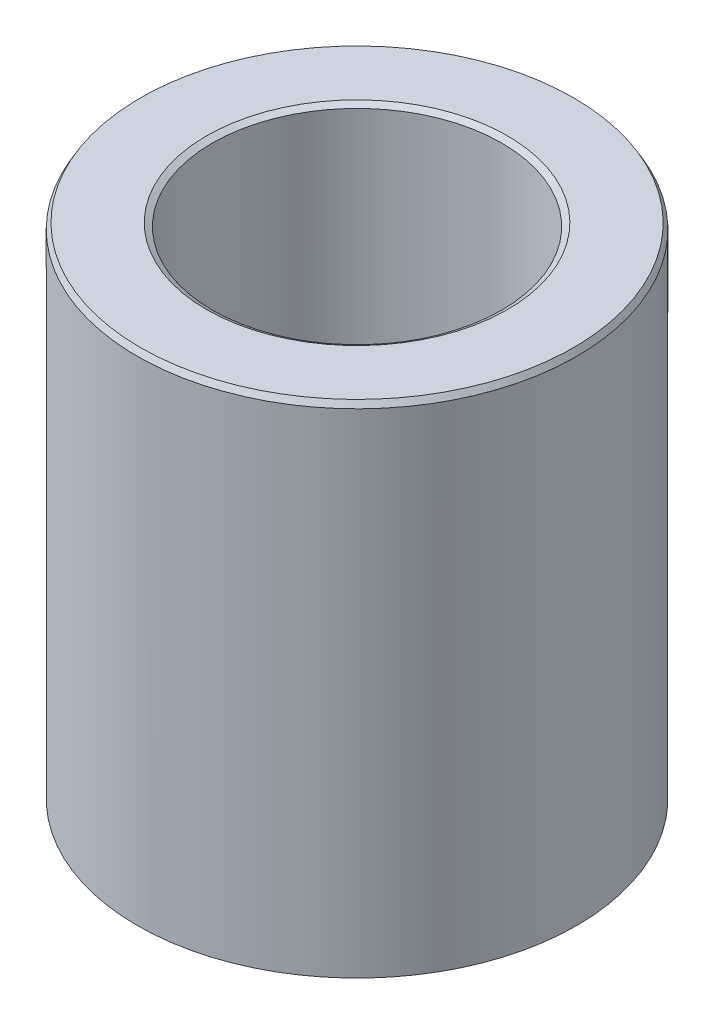
from build123d import *
from OCP.BRepFilletAPI import BRepFilletAPI_MakeChamfer

# Parameters (mm, degrees)
SKETCH1_R           = 45
BOSS_EXTRUDE1_DEPTH = 102.806656635
SKETCH2_R           = 29.628521895
CUT_EXTRUDE1_DEPTH  = 121.909919562
CHAMFER1_SIZE       = 1.183508035
CHAMFER1_SIZE2      = 0.683298682


with BuildPart() as part:
    # Sketch1 → Boss-Extrude1 (new body)
    with BuildSketch(Plane(origin=(0, 0, 0), x_dir=(1, 0, 0), z_dir=(0, 1, 0))):
        Circle(SKETCH1_R)
    extrude(amount=BOSS_EXTRUDE1_DEPTH)

    # Sketch2 → Cut-Extrude1 (cut, through all)
    with BuildSketch(Plane(origin=(0, 0, 0), x_dir=(1, 0, 0), z_dir=(0, 1, 0))):
        Circle(SKETCH2_R)
    extrude(amount=CUT_EXTRUDE1_DEPTH, mode=Mode.SUBTRACT)

    # Chamfer1: one chamfer whose edges measure the first distance from different faces: ONE call of the kernel's chamfer builder (chamfer() names one face for all edges)
    chamfer1_edges_1 = [part.edges().sort_by_distance(p)[0] for p in [
        (-29.628521895, 102.806656635, 0),
    ]]
    chamfer1_side_1 = [part.faces().sort_by_distance(p)[0] for p in [
        (-43.727207794, 102.806656635, 0),
    ]]
    chamfer1_edges_2 = [part.edges().sort_by_distance(p)[0] for p in [
        (-29.628521895, 0, 0),
    ]]
    chamfer1_side_2 = [part.faces().sort_by_distance(p)[0] for p in [
        (-29.628521895, 51.403328318, 0),
    ]]
    chamfer1_edges_3 = [part.edges().sort_by_distance(p)[0] for p in [
        (-45, 0, 0),
    ]]
    chamfer1_side_3 = [part.faces().sort_by_distance(p)[0] for p in [
        (-43.727207794, 0, 0),
    ]]
    chamfer1_edges_4 = [part.edges().sort_by_distance(p)[0] for p in [
        (-45, 102.806656635, 0),
    ]]
    chamfer1_side_4 = [part.faces().sort_by_distance(p)[0] for p in [
        (-45, 51.403328318, 0),
    ]]
    chamfer1 = BRepFilletAPI_MakeChamfer(part.part.solid().wrapped)
    for e in chamfer1_edges_1:
        chamfer1.Add(CHAMFER1_SIZE, CHAMFER1_SIZE2, e.wrapped, chamfer1_side_1[0].wrapped)  # the first distance lies on this face
    for e in chamfer1_edges_2:
        chamfer1.Add(CHAMFER1_SIZE, CHAMFER1_SIZE2, e.wrapped, chamfer1_side_2[0].wrapped)  # the first distance lies on this face
    for e in chamfer1_edges_3:
        chamfer1.Add(CHAMFER1_SIZE, CHAMFER1_SIZE2, e.wrapped, chamfer1_side_3[0].wrapped)  # the first distance lies on this face
    for e in chamfer1_edges_4:
        chamfer1.Add(CHAMFER1_SIZE, CHAMFER1_SIZE2, e.wrapped, chamfer1_side_4[0].wrapped)  # the first distance lies on this face
    add(Compound.cast(chamfer1.Shape()), mode=Mode.REPLACE)


solid = part.part
